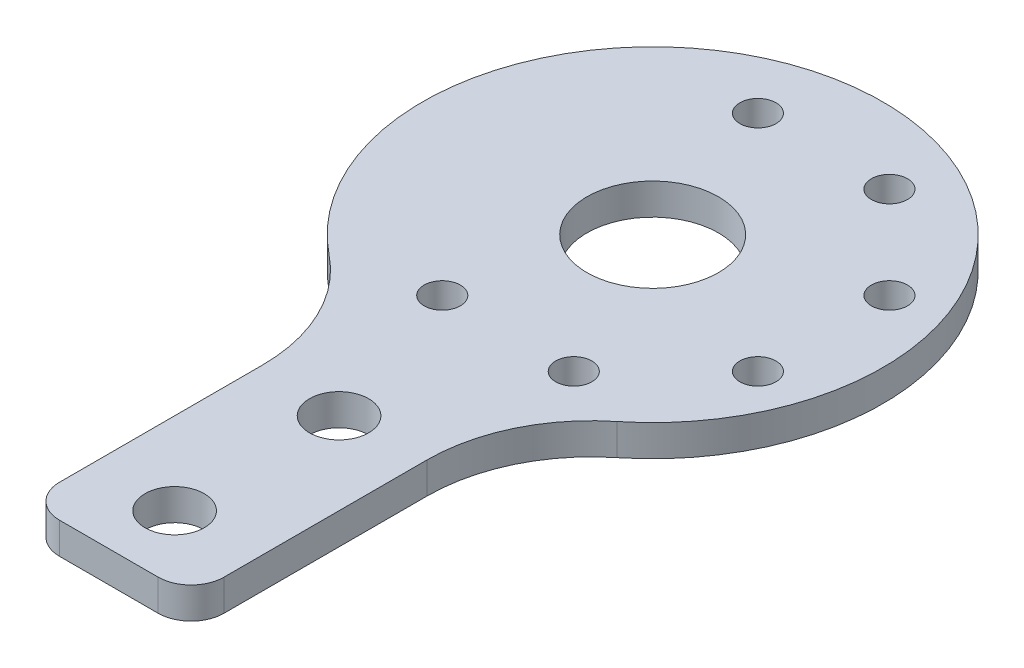
from build123d import *

# Parameters (mm, degrees)
BOSS_EXTRUDE1_DEPTH            = 4.7625
SKETCH5_R                      = 10
CUT_EXTRUDE1_DEPTH             = 90.919995629
M8_CLEARANCE_HOLE1_D           = 9
FILLET1_R                      = 25
M5_CLEARANCE_HOLE1_D           = 5.5
M5_CLEARANCE_HOLE1_CSINK_D     = 5.55
M5_CLEARANCE_HOLE1_CSINK_ANGLE = 90
FILLET2_R                      = 5


with BuildPart() as part:
    # Sketch1 → Boss-Extrude1 (new body)
    with BuildSketch(Plane(origin=(0, 0, 0), x_dir=(1, 0, 0), z_dir=(0, 1, 0))):
        with BuildLine():
            Line((-12.5, -82.691742077), (12.5, -82.691742077))
            Line((12.5, -82.691742077), (12.5, -32.691742077))
            ThreePointArc((12.5, -32.691742077), (0, 35), (-12.5, -32.691742077))
            Line((-12.5, -32.691742077), (-12.5, -82.691742077))
        make_face()
    extrude(amount=BOSS_EXTRUDE1_DEPTH)

    # Sketch5 → Cut-Extrude1 (cut, through all)
    with BuildSketch(Plane.XZ):
        Circle(SKETCH5_R)
    extrude(amount=-CUT_EXTRUDE1_DEPTH, mode=Mode.SUBTRACT)

    # M8 Clearance Hole1 (through all)
    with Locations(Plane(origin=(0, 0, 0), x_dir=(-1, 0, 0), z_dir=(0, -1, 0))):
        with Locations((0, -47.691742077), (0, -72.691742077)):
            Hole(M8_CLEARANCE_HOLE1_D / 2)

    # Fillet1
    fillet1_edges = [part.edges().sort_by_distance(p)[0] for p in [
        (-12.5, 2.38125, 32.691742077),
        (12.5, 2.38125, 32.691742077),
    ]]
    fillet(fillet1_edges, radius=FILLET1_R)

    # M5 Clearance Hole1 (through all)
    with Locations(Plane(origin=(0, 0, 0), x_dir=(-1, 0, 0), z_dir=(0, -1, 0))):
        with Locations((-12, 24), (8, 24), (-26, 10), (-26, -10), (-12, -24), (8, -24)):
            CounterSinkHole(M5_CLEARANCE_HOLE1_D / 2, M5_CLEARANCE_HOLE1_CSINK_D / 2, counter_sink_angle=M5_CLEARANCE_HOLE1_CSINK_ANGLE)

    # Fillet2
    fillet2_edges = [part.edges().sort_by_distance(p)[0] for p in [
        (-12.5, 2.38125, 82.691742077),
        (12.5, 2.38125, 82.691742077),
    ]]
    fillet(fillet2_edges, radius=FILLET2_R)


solid = part.part
